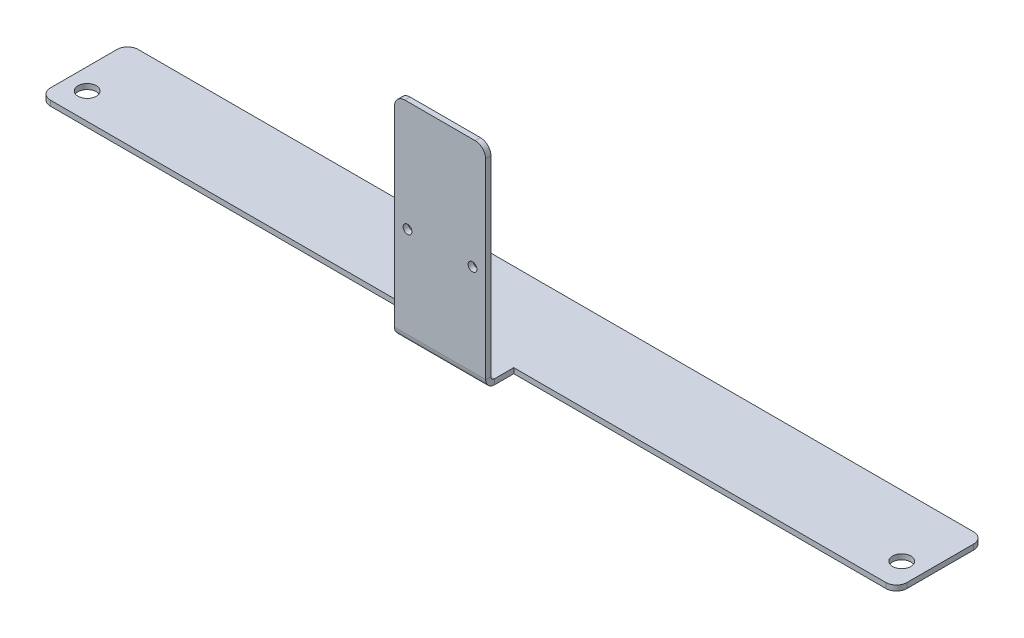
from build123d import *

# Parameters (mm, degrees)
SKETCH_2_W              = 244
SKETCH_2_H              = 25
SM_BASE_FLANGE_1_DEPTH  = 1.5
SM_EDGE_FLANGE_1_DEPTH  = 26
HOLE_WIZARD_5_2_5_2_1_D = 5.2
HOLE_WIZARD_M3_1_D      = 2.5
FILLET_1_R              = 3


# Sheet-metal steps are written as plain solids
with BuildPart() as part:
    # Sketch 2 → 基体-法兰1 (new body)
    with BuildSketch(Plane(origin=(0, 0, 0), x_dir=(1, 0, 0), z_dir=(0, 1, 0))):
        Rectangle(SKETCH_2_W, SKETCH_2_H)
    extrude(amount=-SM_BASE_FLANGE_1_DEPTH)

    # 边线-法兰1 section (across the edge) → 边线-法兰1 (add)
    with BuildSketch(Plane(origin=(-13, 0, 20.5), x_dir=(0, 0, -1), z_dir=(1, 0, 0))):
        with BuildLine():
            Line((0, 1), (0, 58.5))
            Line((0, 58.5), (1.5, 58.5))
            Line((1.5, 58.5), (1.5, 1))
            ThreePointArc((1.5, 1), (1.792893219, 0.292893219), (2.5, 0))
            Line((2.5, 0), (8, 0))
            Line((8, 0), (8, -1.5))
            Line((8, -1.5), (2.5, -1.5))
            ThreePointArc((2.5, -1.5), (0.732233047, -0.767766953), (0, 1))
        make_face()
    extrude(amount=SM_EDGE_FLANGE_1_DEPTH)

    # Ø5.2 (5.2) 直径孔1 (through all)
    with Locations(Plane(origin=(0, -1.5, 0), x_dir=(-1, 0, 0), z_dir=(0, -1, 0))):
        with Locations((116, -5), (-116, -5)):
            Hole(HOLE_WIZARD_5_2_5_2_1_D / 2)

    # M3 螺纹孔1 (through all)
    with Locations(Plane.XY.offset(20.5)):
        with Locations((-9.25, 27), (9.25, 27)):
            Hole(HOLE_WIZARD_M3_1_D / 2)

    # 圆角1
    fillet_1_edges = [part.edges().sort_by_distance(p)[0] for p in [
        (122, -0.75, -12.5),
        (122, -0.75, 12.5),
        (13, 58.5, 19.75),
        (-13, 58.5, 19.75),
        (-122, -0.75, 12.5),
        (-122, -0.75, -12.5),
    ]]
    fillet(fillet_1_edges, radius=FILLET_1_R)


solid = part.part
